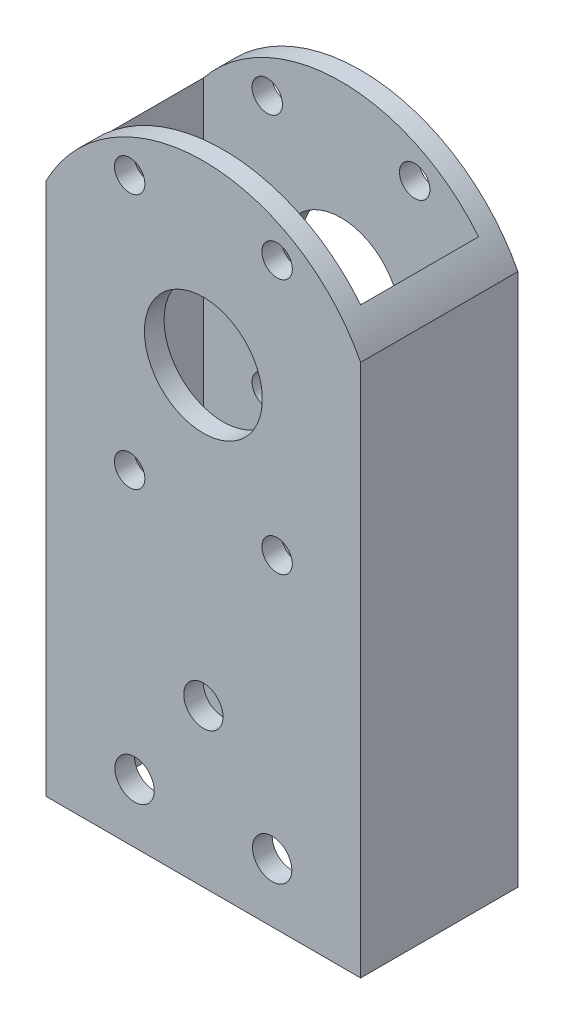
from build123d import *

# Parameters (mm, degrees)
SKETCH1_W                    = 50.8
SKETCH1_H                    = 25.4
SKETCH1_W_2                  = 44.45
SKETCH1_H_2                  = 19.05
EXTRUDE_THIN1_DEPTH          = 101.6
F_10_0_1935_DIAMETER_HOLE2_D = 4.9149
CUT_EXTRUDE2_DEPTH           = 108.763073453
CUT_EXTRUDE2_DEPTH_BACK      = 108.763073453
SKETCH7_R                    = 9.525
F_1_4_0_25_DIAMETER_HOLE1_D  = 6.35
CUT_EXTRUDE3_DEPTH           = 108.763073453
F_1_4_0_25_DIAMETER_HOLE2_D  = 6.35


with BuildPart() as part:
    # Sketch1 → Extrude-Thin1 (new body)
    with BuildSketch(Plane(origin=(0, 0, 0), x_dir=(1, 0, 0), z_dir=(0, 1, 0))):
        Rectangle(SKETCH1_W, SKETCH1_H)
        Rectangle(SKETCH1_W_2, SKETCH1_H_2, mode=Mode.SUBTRACT)
    extrude(amount=EXTRUDE_THIN1_DEPTH)

    # #10 (0.1935) Diameter Hole2 (through all)
    with Locations(Plane(origin=(0, 0, -12.7), x_dir=(-1, 0, 0), z_dir=(0, 0, -1))):
        with Locations((-11.90625, 52.402770072), (-11.90625, 93.647229928), (11.90625, 93.647229928), (11.90625, 52.402770072)):
            Hole(F_10_0_1935_DIAMETER_HOLE2_D / 2)

    # Sketch7 → Cut-Extrude2 (cut, two sides: drawn at the far end of the back side and taken through both)
    with BuildSketch(Plane(origin=(0, 0, -12.7), x_dir=(-1, 0, 0), z_dir=(0, 0, -1)).offset(-CUT_EXTRUDE2_DEPTH_BACK)):
        with Locations((0, 73.025)):
            Circle(SKETCH7_R)
    extrude(amount=CUT_EXTRUDE2_DEPTH + CUT_EXTRUDE2_DEPTH_BACK, mode=Mode.SUBTRACT)

    # 1/4 (0.25) Diameter Hole1 (through all)
    with Locations(Plane.XY.offset(12.7)):
        with Locations((-11.1125, 9.525), (11.1125, 9.525), (-109.171479686, 68.785430569)):
            Hole(F_1_4_0_25_DIAMETER_HOLE1_D / 2)

    # Sketch10 → Cut-Extrude3 (cut, through all)
    with BuildSketch(Plane(origin=(0, 0, -12.7), x_dir=(-1, 0, 0), z_dir=(0, 0, -1))):
        with BuildLine():
            Line((25.4, 101.6), (0, 101.6))
            ThreePointArc((0, 101.6), (14.873790542, 97.423790542), (25.4, 86.115860361))
            Line((25.4, 86.115860361), (25.4, 101.6))
        make_face()
        with BuildLine():
            Line((-25.4, 101.6), (-25.4, 86.115860361))
            ThreePointArc((-25.4, 86.115860361), (-14.873790542, 97.423790542), (0, 101.6))
            Line((0, 101.6), (-25.4, 101.6))
        make_face()
    extrude(amount=-CUT_EXTRUDE3_DEPTH, mode=Mode.SUBTRACT)

    # 1/4 (0.25) Diameter Hole2 (through all)
    with Locations(Plane.XY.offset(12.7)):
        with Locations((0, 25.4)):
            Hole(F_1_4_0_25_DIAMETER_HOLE2_D / 2)


solid = part.part
